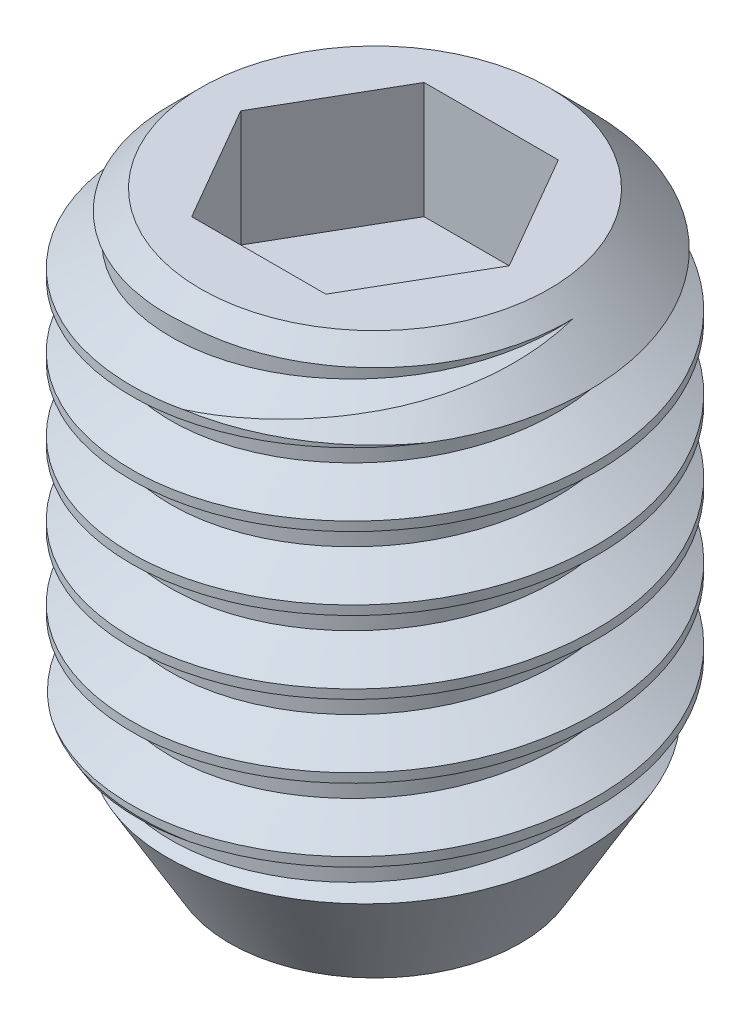
from build123d import *

# Parameters (mm, degrees)
CUT_EXTRUDE1_DEPTH = 2
THREAD1_PITCH      = 1.25


with BuildPart() as part:
    # Sketch2 → Revolve1 (revolve)
    with BuildSketch(Plane.XY, mode=Mode.PRIVATE) as revolve1_sk:
        Polygon((0, 10), (3, 10), (4, 9), (4, 2.598076211), (2.5, 0), (0, 0), align=None)
    revolve(revolve1_sk.sketch.rotate(Axis((0, 0, 0), (0, 1, 0)), 90), axis=Axis((0, 0, 0), (0, 1, 0)))

    # Sketch3 → Cut-Extrude1 (cut)
    with BuildSketch(Plane(origin=(0, 10, 0), x_dir=(1, 0, 0), z_dir=(0, 1, 0))):
        Polygon((2.309401077, 0), (1.154700538, 2), (-1.154700538, 2), (-2.309401077, 0), (-1.154700538, -2), (1.154700538, -2), align=None)
    extrude(amount=-CUT_EXTRUDE1_DEPTH, mode=Mode.SUBTRACT)

    # Thread1: the profile of Thread Profile1 profile screwed along a right-hand helix of 8.8 turns, 8 arcs to a turn; built about Z, then put on its axis
    thread1_z = Axis((0, 0, 0), (0, 0, 1))
    thread1_corners = [(4.0003, 0, -0.000173205), (4.0003, 0, 1.093923202), (3.323417656, 0, 0.703124998), (3.323417656, 0, 0.390624998)]
    with BuildLine(mode=Mode.PRIVATE) as thread1_profile:
        Line(thread1_corners[0], thread1_corners[1])
        Line(thread1_corners[1], thread1_corners[2])
        Line(thread1_corners[2], thread1_corners[3])
        Line(thread1_corners[3], thread1_corners[0])
    thread1_cap = Face(thread1_profile.wire())
    thread1_turn_angles = [0, 22.5, 45, 67.5, 90, 112.5, 135, 157.5, 180, 202.5, 225, 247.5, 270, 292.5, 315, 337.5, 360]
    thread1_turn_weights = [1, 0.9238795325112867, 1, 0.9238795325112867, 1, 0.9238795325112867, 1, 0.9238795325112867, 1, 0.9238795325112867, 1, 0.9238795325112867, 1, 0.9238795325112867, 1, 0.9238795325112867, 1]
    thread1_turn_rails = [Edge.make_bspline([Vector(p[0], p[1], 0).rotate(thread1_z, thread1_turn_angles[k]) / thread1_turn_weights[k] + Vector(0, 0, p[2] + THREAD1_PITCH * thread1_turn_angles[k] / 360) for k in range(17)], [0, 0, 0, 1, 1, 2, 2, 3, 3, 4, 4, 5, 5, 6, 6, 7, 7, 8, 8, 8], 2, thread1_turn_weights) for p in thread1_corners]
    thread1_turn_sides = [Face.make_surface_from_curves(thread1_turn_rails[p[0]], thread1_turn_rails[p[1]]) for p in [(0, 1), (1, 2), (2, 3), (3, 0)]]
    thread1_last_angles = [2880, 2902.5, 2925, 2947.5, 2970, 2992.5, 3015, 3037.5, 3060, 3082.5, 3105, 3127.5, 3150, 3159, 3168]
    thread1_last_weights = [1, 0.9238795325112867, 1, 0.9238795325112867, 1, 0.9238795325112867, 1, 0.9238795325112867, 1, 0.9238795325112867, 1, 0.9238795325112867, 1, 0.9876883405951371, 1]
    thread1_last_rails = [Edge.make_bspline([Vector(p[0], p[1], 0).rotate(thread1_z, thread1_last_angles[k]) / thread1_last_weights[k] + Vector(0, 0, p[2] + THREAD1_PITCH * thread1_last_angles[k] / 360) for k in range(15)], [0, 0, 0, 1, 1, 2, 2, 3, 3, 4, 4, 5, 5, 6, 6, 7, 7, 7], 2, thread1_last_weights) for p in thread1_corners]
    thread1_last_sides = [Face.make_surface_from_curves(thread1_last_rails[p[0]], thread1_last_rails[p[1]]) for p in [(0, 1), (1, 2), (2, 3), (3, 0)]]
    thread1 = Plane(origin=(0, 11, 0), x_dir=(-1, 0, 0), z_dir=(0, -1, 0)) * Solid(Shell([*[p.moved(Location((0, 0, THREAD1_PITCH * i))) for i in range(8) for p in thread1_turn_sides], *thread1_last_sides, thread1_cap, thread1_cap.rotate(thread1_z, 3168).moved(Location((0, 0, THREAD1_PITCH * 3168 / 360)))]))
    add(thread1, mode=Mode.SUBTRACT)


solid = part.part
